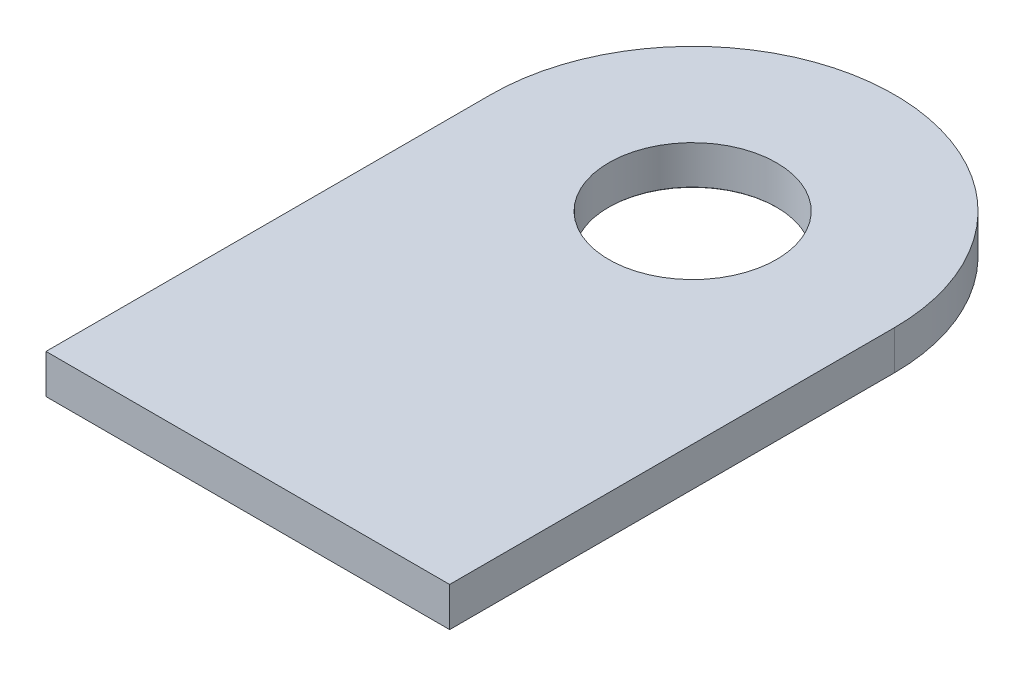
from build123d import *

# Parameters (mm, degrees)
BOSS_EXTRUDE1_DEPTH = 1.54


with BuildPart() as part:
    # Sketch1 → Boss-Extrude1 (new body)
    with BuildSketch(Plane(origin=(0, 0, 0), x_dir=(1, 0, 0), z_dir=(0, 1, 0))):
        with BuildLine():
            Line((7.94, -17.5), (7.94, 0))
            ThreePointArc((7.94, 0), (0, 7.94), (-7.94, 0))
            Line((-7.94, 0), (-7.94, -17.5))
            Line((-7.94, -17.5), (7.94, -17.5))
        make_face()
    extrude(amount=BOSS_EXTRUDE1_DEPTH)

    # Sketch3 → M6 Clearance Hole1 (revolve, cut)
    with BuildSketch(Plane(origin=(0, 0, 0), x_dir=(0, 0, -1), z_dir=(1, 0, 0))):
        Polygon((0, 0), (0, 1.54), (3.3, 1.54), (3.3, 0.025), (3.325, 0), align=None)
    revolve(axis=Axis((0, -6.35, 0), (0, 1, 0)), mode=Mode.SUBTRACT)


solid = part.part
